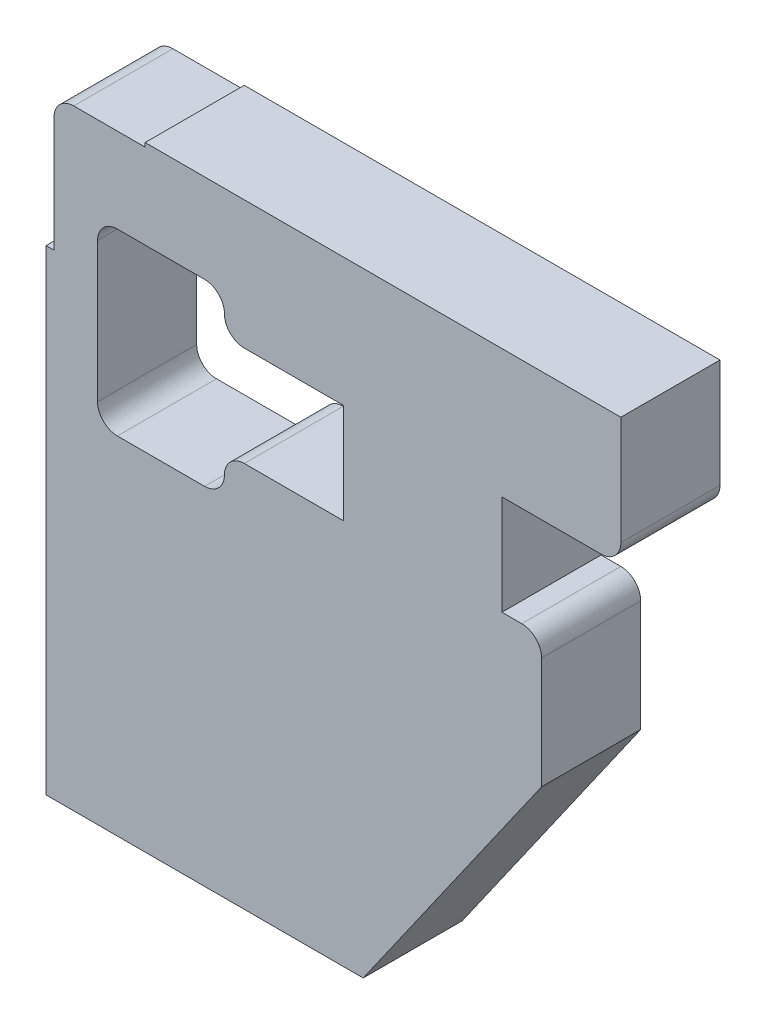
from build123d import *

# Parameters (mm, degrees)
BOSS_EXTRUDE1_DEPTH = 0.125
FILLET1_R           = 0.05


with BuildPart() as part:
    # frame_outline → Boss-Extrude1 (new, symmetric)
    with BuildSketch(Plane.XY):
        Polygon((0.3, -0.05), (1.5, -0.05), (1.5, -0.374), (1.2, -0.374), (1.2, -0.626), (1.3, -0.626), (1.3, -0.957333397), (0.85, -1.6), (0.05, -1.6), (0.05, -0.4), (0.07, -0.4), (0.07, -0.06), (0.3, -0.06), align=None)
        Polygon((0.5, -0.374), (0.8, -0.374), (0.8, -0.626), (0.5, -0.626), (0.5, -0.726), (0.18, -0.726), (0.18, -0.274), (0.5, -0.274), align=None, mode=Mode.SUBTRACT)
    extrude(amount=BOSS_EXTRUDE1_DEPTH, both=True)

    # Fillet1
    fillet1_edges = [part.edges().sort_by_distance(p)[0] for p in [
        (1.3, -0.626, 0),
        (1.5, -0.374, 0),
        (0.5, -0.374, 0),
        (0.5, -0.626, 0),
        (0.5, -0.726, 0),
        (0.18, -0.726, 0),
        (0.5, -0.274, 0),
        (0.18, -0.274, 0),
        (0.07, -0.06, 0),
    ]]
    fillet(fillet1_edges, radius=FILLET1_R - 0.0001)  # a hair under: the kernel refuses the full size


solid = part.part
